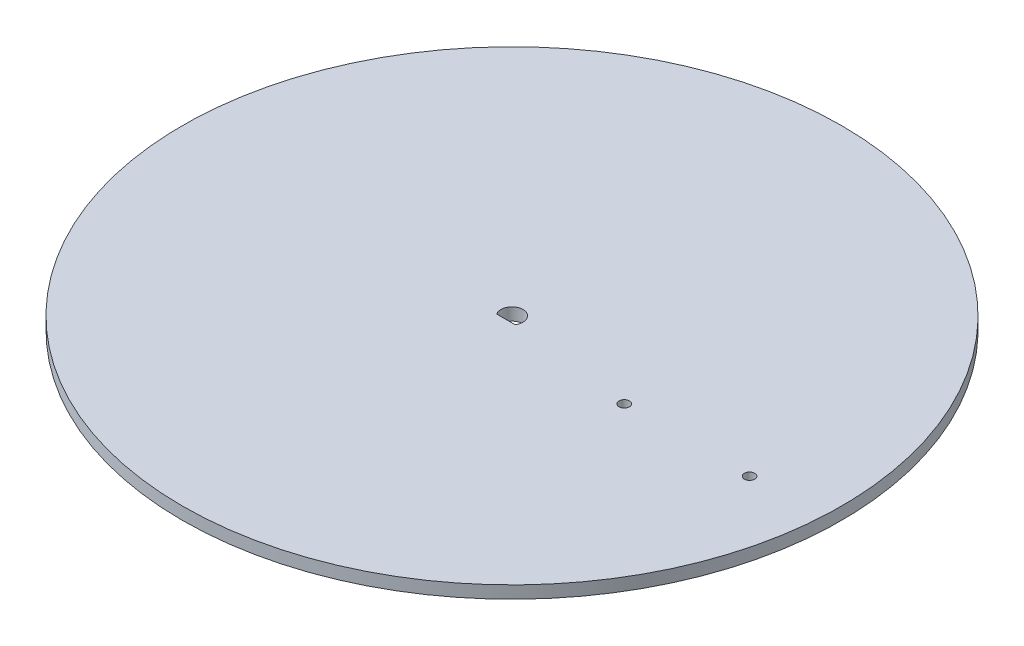
from build123d import *

# Parameters (mm, degrees)
RECORD_R             = 67.31
RECORD_R_2           = 1.054294776
RECORD_EXTRUDE_DEPTH = 2.54
MOTOR_HOLE_DEPTH     = 2.54


# Read off the part's stored shape, not the designer's step: Motor Hole
with BuildPart() as part:
    # Record → Record Extrude (new body)
    with BuildSketch(Plane(origin=(0, 0, 0), x_dir=(1, 0, 0), z_dir=(0, 1, 0))):
        with Locations(Location((13.743289035, -70.841587708, 0), (0, 0, 270))):
            Circle(RECORD_R)
        with Locations(Location((66.372058646, -74.952013208, 0), (0, 0, 270))):
            Circle(RECORD_R_2, mode=Mode.SUBTRACT)
        with Locations(Location((40.779568941, -74.952013208, 0), (0, 0, 270))):
            Circle(RECORD_R_2, mode=Mode.SUBTRACT)
    extrude(amount=RECORD_EXTRUDE_DEPTH)

    # Motor Hole outline → Motor Hole (cut)
    with BuildSketch(Plane(origin=(0, 0, 0), x_dir=(1, 0, 0), z_dir=(0, 1, 0))):
        with BuildLine():
            Line((11.872460342, -72.091587708), (15.614117728, -72.091587708))
            ThreePointArc((15.614117728, -72.091587708), (13.743289035, -68.591587708), (11.872460342, -72.091587708))
        make_face()
    extrude(amount=MOTOR_HOLE_DEPTH, mode=Mode.SUBTRACT)


solid = part.part
